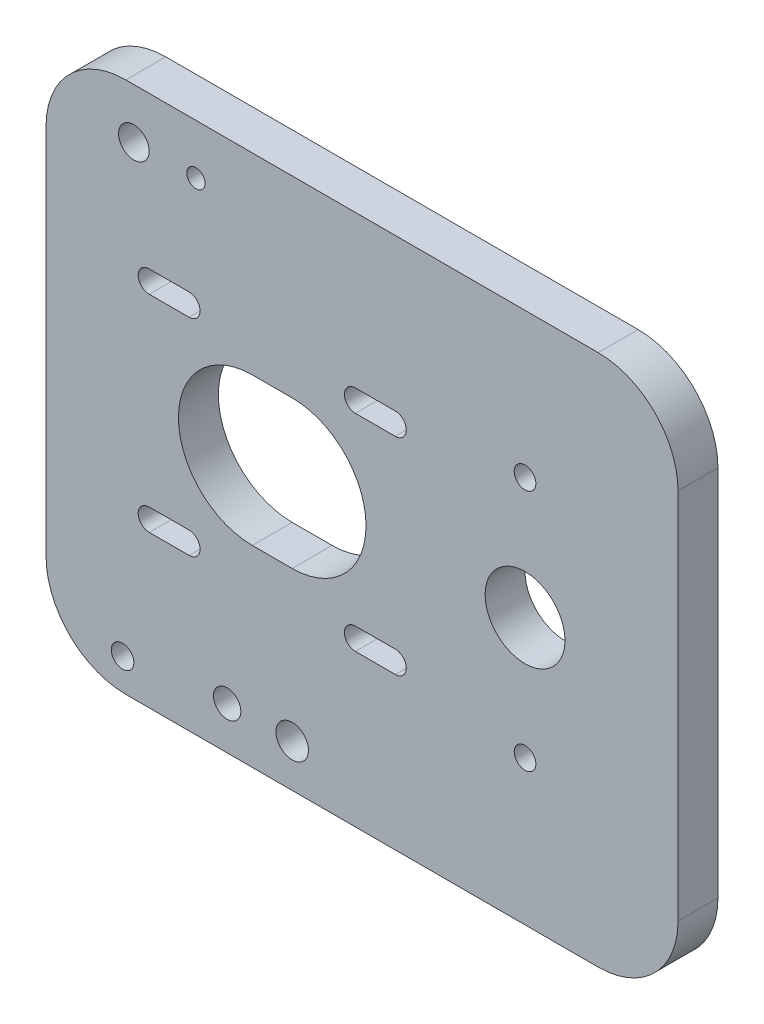
from build123d import *

# Parameters (mm, degrees)
CROQUIS1_W              = 95
CROQUIS1_H              = 80
SALIENTE_EXTRUIR1_DEPTH = 6
CROQUIS2_R              = 6
CROQUIS2_R_2            = 1.625
CROQUIS2_R_3            = 1.692883882
CROQUIS2_R_4            = 2.057537899
CROQUIS2_R_5            = 2.444629319
CROQUIS2_R_6            = 2.301638611
CROQUIS2_R_7            = 1.371590974
CORTAR_EXTRUIR1_DEPTH   = 125.342269563
REDONDEO1_R             = 12


with BuildPart() as part:
    # Croquis1 → Saliente-Extruir1 (new body)
    with BuildSketch(Plane.XY):
        with Locations((47.5, 40)):
            Rectangle(CROQUIS1_W, CROQUIS1_H)
    extrude(amount=SALIENTE_EXTRUIR1_DEPTH)

    # Croquis2 → Cortar-Extruir1 (cut, through all)
    with BuildSketch(Plane(origin=(0, 0, 0), x_dir=(-1, 0, 0), z_dir=(0, 0, -1))):
        with Locations((-72, 40)):
            Circle(CROQUIS2_R)
        with Locations((-72, 21.75)):
            Circle(CROQUIS2_R_2)
        with Locations((-72, 58.25)):
            Circle(CROQUIS2_R_2)
        with Locations((-11.505477507, 4.731591769)):
            Circle(CROQUIS2_R_3)
        with Locations((-27.221232596, 6.424475651)):
            Circle(CROQUIS2_R_4)
        with Locations((-37, 6.424475651)):
            Circle(CROQUIS2_R_5)
        with Locations((-13.198361389, 72.469400829)):
            Circle(CROQUIS2_R_6)
        with Locations((-22.531941303, 72.469400829)):
            Circle(CROQUIS2_R_7)
        with BuildLine():
            Line((-31, 28.9), (-37, 28.9))
            ThreePointArc((-37, 28.9), (-48.1, 40), (-37, 51.1))
            Line((-37, 51.1), (-31, 51.1))
            ThreePointArc((-31, 51.1), (-19.9, 40), (-31, 28.9))
        make_face()
        with BuildLine():
            Line((-15.5, 22.85), (-21.5, 22.85))
            ThreePointArc((-21.5, 22.85), (-23.15, 24.5), (-21.5, 26.15))
            Line((-21.5, 26.15), (-15.5, 26.15))
            ThreePointArc((-15.5, 26.15), (-13.85, 24.5), (-15.5, 22.85))
        make_face()
        with BuildLine():
            Line((-46.5, 53.85), (-52.5, 53.85))
            ThreePointArc((-52.5, 53.85), (-54.15, 55.5), (-52.5, 57.15))
            Line((-52.5, 57.15), (-46.5, 57.15))
            ThreePointArc((-46.5, 57.15), (-44.85, 55.5), (-46.5, 53.85))
        make_face()
        with BuildLine():
            Line((-46.5, 22.85), (-52.5, 22.85))
            ThreePointArc((-52.5, 22.85), (-54.15, 24.5), (-52.5, 26.15))
            Line((-52.5, 26.15), (-46.5, 26.15))
            ThreePointArc((-46.5, 26.15), (-44.85, 24.5), (-46.5, 22.85))
        make_face()
        with BuildLine():
            Line((-15.5, 53.85), (-21.5, 53.85))
            ThreePointArc((-21.5, 53.85), (-23.15, 55.5), (-21.5, 57.15))
            Line((-21.5, 57.15), (-15.5, 57.15))
            ThreePointArc((-15.5, 57.15), (-13.85, 55.5), (-15.5, 53.85))
        make_face()
    extrude(amount=-CORTAR_EXTRUIR1_DEPTH, mode=Mode.SUBTRACT)

    # Redondeo1
    redondeo1_edges = [part.edges().sort_by_distance(p)[0] for p in [
        (95, 0, 3),
        (95, 80, 3),
        (0, 0, 3),
        (0, 80, 3),
    ]]
    fillet(redondeo1_edges, radius=REDONDEO1_R)


solid = part.part
